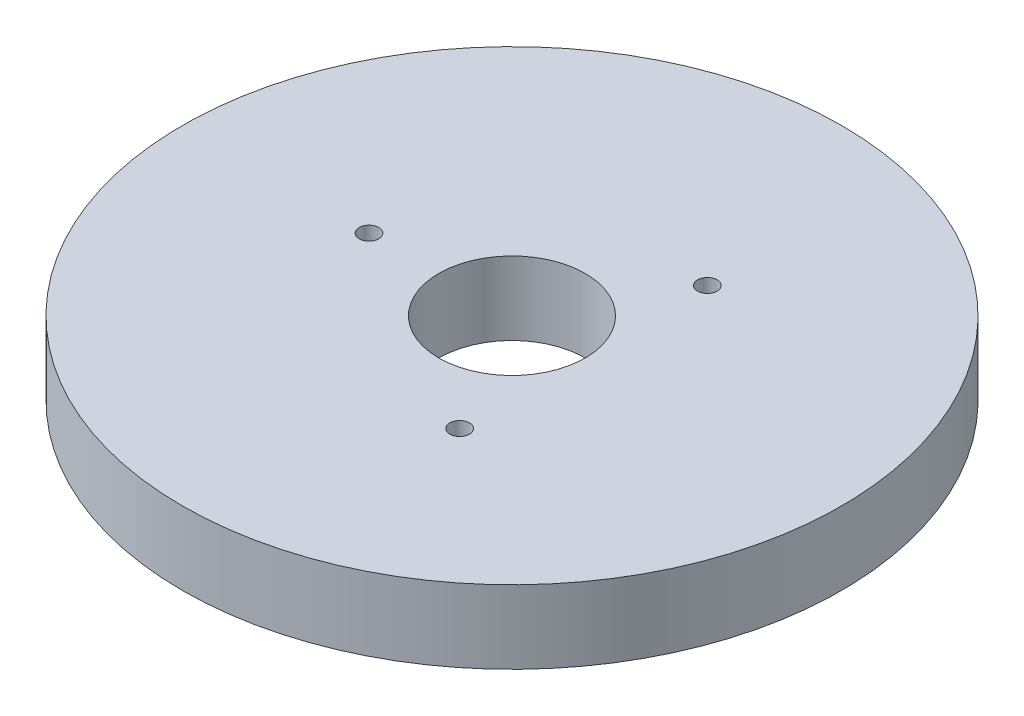
from build123d import *

# Parameters (mm, degrees)
SKETCH1_R           = 90
BOSS_EXTRUDE1_DEPTH = 20
SKETCH2_R           = 20
CUT_EXTRUDE1_DEPTH  = 129.840987267
SKETCH3_R           = 2.675801007
CUT_EXTRUDE2_DEPTH  = 12.249332849
CIRPATTERN1_COUNT   = 3


with BuildPart() as part:
    # Sketch1 → Boss-Extrude1 (new body)
    with BuildSketch(Plane(origin=(0, 0, 0), x_dir=(1, 0, 0), z_dir=(0, 1, 0))):
        Circle(SKETCH1_R)
    extrude(amount=BOSS_EXTRUDE1_DEPTH)

    # Sketch2 → Cut-Extrude1 (cut, through all)
    with BuildSketch(Plane(origin=(0, 0, 0), x_dir=(1, 0, 0), z_dir=(0, 1, 0))):
        Circle(SKETCH2_R)
    extrude(amount=CUT_EXTRUDE1_DEPTH, mode=Mode.SUBTRACT)

    # Sketch3 → Cut-Extrude2 (cut)
    with BuildSketch(Plane(origin=(0, 20, 0), x_dir=(1, 0, 0), z_dir=(0, 1, 0))):
        with Locations((-39.058003798, 0)):
            Circle(SKETCH3_R)
    cut_extrude2 = extrude(amount=-CUT_EXTRUDE2_DEPTH, mode=Mode.SUBTRACT)

    # CirPattern1: Cut-Extrude2 ×3 about axis
    cirpattern1_axis = Axis((0, 0, 0), (0, 1, 0))
    for i in range(1, CIRPATTERN1_COUNT):
        add(cut_extrude2.rotate(cirpattern1_axis, i * 360 / CIRPATTERN1_COUNT), mode=Mode.SUBTRACT)


solid = part.part
